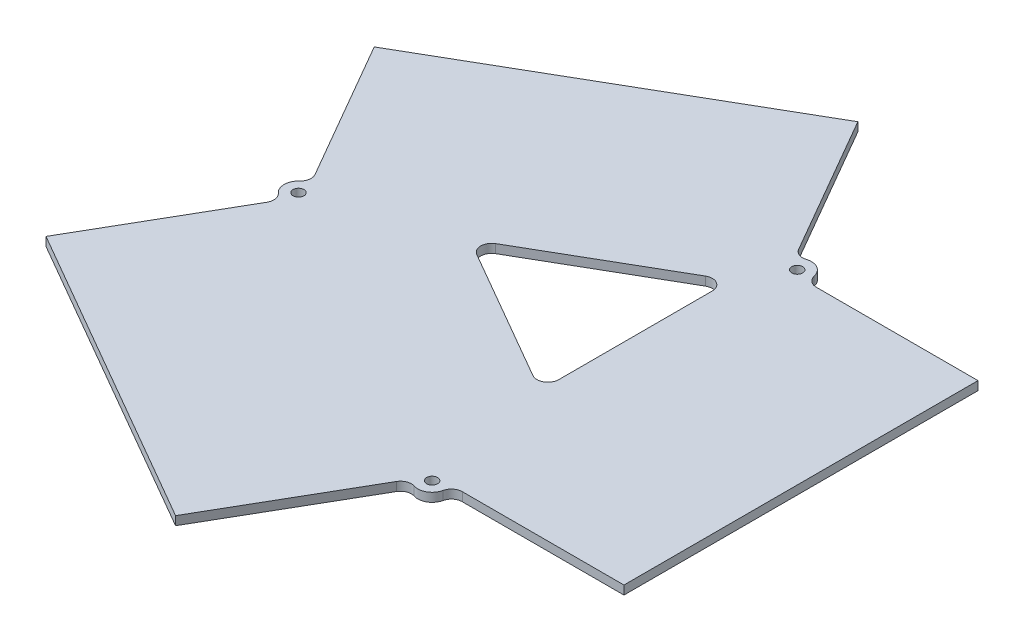
from build123d import *

# Parameters (mm, degrees)
SKETCH1_R           = 1.25
BOSS_EXTRUDE1_DEPTH = 2
FILLET1_R           = 2.5


with BuildPart() as part:
    # Sketch1 → Boss-Extrude1 (new body)
    with BuildSketch(Plane(origin=(0, 0, 0), x_dir=(1, 0, 0), z_dir=(0, 1, 0))):
        with BuildLine():
            Line((-28.704955076, 110.614269791), (-98.853012782, 70.114269791))
            Line((-98.853012782, 70.114269791), (-79.046194877, 35.807854842))
            ThreePointArc((-79.046194877, 35.807854842), (-81.904272288, 32.566847179), (-79.046194877, 29.325839516))
            Line((-79.046194877, 29.325839516), (-98.853012782, -4.980575433))
            Line((-98.853012782, -4.980575433), (-28.704955076, -45.480575433))
            Line((-28.704955076, -45.480575433), (-8.89813717, -11.174160484))
            ThreePointArc((-8.89813717, -11.174160484), (-4.662303494, -12.028824296), (-3.28454723, -7.933152821))
            Line((-3.28454723, -7.933152821), (36.329088581, -7.933152821))
            Line((36.329088581, -7.933152821), (36.329088581, 73.066847179))
            Line((36.329088581, 73.066847179), (-3.28454723, 73.066847179))
            ThreePointArc((-3.28454723, 73.066847179), (-4.662303494, 77.162518655), (-8.89813717, 76.307854842))
            Line((-8.89813717, 76.307854842), (-28.704955076, 110.614269791))
        make_face()
        Polygon((-49.73679844, 42.872400793), (-11.821169189, 64.762999548), (-11.821169189, 20.981802038), align=None, mode=Mode.SUBTRACT)
        with Locations((-6.295633744, -9.199813319)):
            Circle(SKETCH1_R, mode=Mode.SUBTRACT)
        with Locations((-78.637611789, 32.566847179)):
            Circle(SKETCH1_R, mode=Mode.SUBTRACT)
        with Locations((-6.295633744, 74.333507677)):
            Circle(SKETCH1_R, mode=Mode.SUBTRACT)
    extrude(amount=BOSS_EXTRUDE1_DEPTH)

    # Fillet1
    fillet1_edges = [part.edges().sort_by_distance(p)[0] for p in [
        (-8.89813717, 1, -76.307854842),
        (-3.28454723, 1, -73.066847179),
        (-8.89813717, 1, 11.174160484),
        (-3.28454723, 1, 7.933152821),
        (-79.046194877, 1, -29.325839516),
        (-79.046194877, 1, -35.807854842),
        (-11.821169189, 1, -20.981802038),
        (-49.73679844, 1, -42.872400793),
        (-11.821169189, 1, -64.762999548),
    ]]
    fillet(fillet1_edges, radius=FILLET1_R)


solid = part.part
